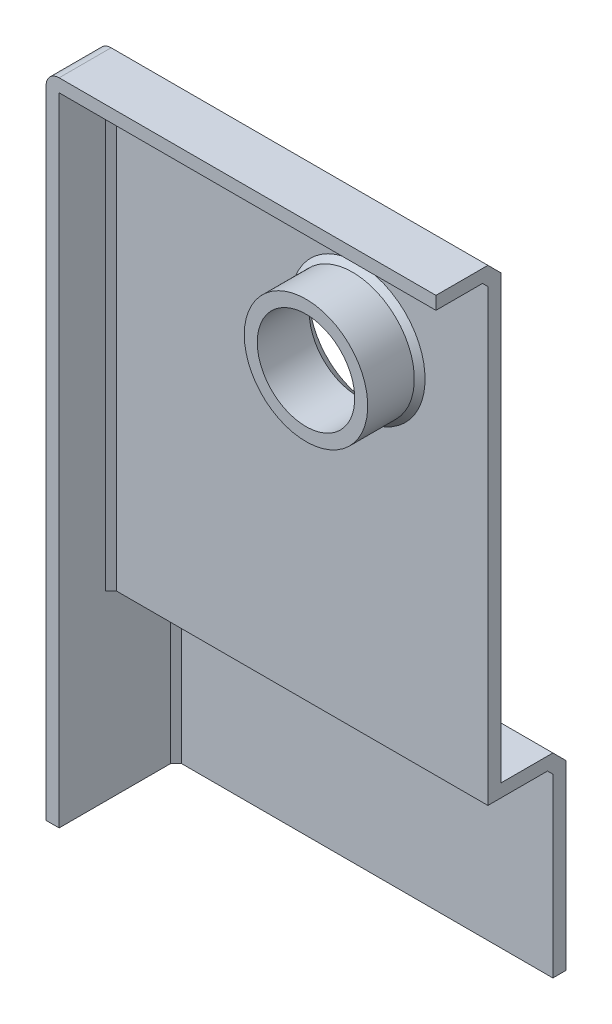
from build123d import *

# Parameters (mm, degrees)
SKETCH1_W           = 76.2
SKETCH1_H           = 127
BOSS_EXTRUDE2_DEPTH = 12.7
SKETCH2_W           = 76.2
SKETCH2_H           = 38.1
BOSS_EXTRUDE3_DEPTH = 12.7
SKETCH4_R           = 9.525
CUT_EXTRUDE1_DEPTH  = 149.649688866
FILLET1_R           = 2.54
CHAMFER1_SIZE       = 2.54
SHELL1_START        = 2.54
SHELL1_DEPTH        = 73.66
SHELL1_START_2      = 35.56
SHELL1_3_DEPTH      = 89.44
SHELL1_4_DEPTH      = 35.56


with BuildPart() as part:
    # Sketch1 → Boss-Extrude2 (new body)
    with BuildSketch(Plane.XY):
        with Locations((38.1, 63.5)):
            Rectangle(SKETCH1_W, SKETCH1_H)
    extrude(amount=BOSS_EXTRUDE2_DEPTH)

    # Sketch2 → Boss-Extrude3 (add)
    with BuildSketch(Plane(origin=(0, 0, 0), x_dir=(-1, 0, 0), z_dir=(0, 0, -1))):
        with Locations((-38.1, 19.05)):
            Rectangle(SKETCH2_W, SKETCH2_H)
    extrude(amount=BOSS_EXTRUDE3_DEPTH)

    # Sketch4 → Cut-Extrude1 (cut, through all)
    with BuildSketch(Plane(origin=(0, 0, 0), x_dir=(-1, 0, 0), z_dir=(0, 0, -1))):
        with Locations((-50.8, 101.6)):
            Circle(SKETCH4_R)
    extrude(amount=-CUT_EXTRUDE1_DEPTH, mode=Mode.SUBTRACT)

    # Fillet1
    fillet1_edges = [part.edges().sort_by_distance(p)[0] for p in [
        (0, 38.1, -6.35),
        (0, 127, 6.35),
    ]]
    fillet(fillet1_edges, radius=FILLET1_R)

    # Chamfer1
    chamfer1_edges = [part.edges().sort_by_distance(p)[0] for p in [
        (60.325, 101.6, 0),
        (0, 80.01, 0),
        (0.743948776, 126.256051224, 0),
        (39.37, 127, 0),
        (0, 17.78, -12.7),
        (0.743948776, 37.356051224, -12.7),
        (39.37, 38.1, -12.7),
    ]]
    chamfer(chamfer1_edges, length=CHAMFER1_SIZE)

    # Shell1: read off the stored shape, not the designer's step
    # Shell1 outline → Shell1 (cut)
    with BuildSketch(Plane.YZ.offset(SHELL1_START)):
        Polygon((124.46, 3.592102448), (124.46, 12.7), (0, 12.7), (0, -10.16), (34.507897552, -10.16), (35.56, -9.107897552), (35.56, 2.54), (123.407897552, 2.54), align=None)
    extrude(amount=SHELL1_DEPTH, mode=Mode.SUBTRACT)

    # Shell1 2 outline → Shell1 2 (revolve)
    with BuildSketch(Plane(origin=(50.8, 101.6, 0), x_dir=(1, 0, 0), z_dir=(0, -1, 0))):
        Polygon((12.065, 12.7), (9.525, 12.7), (9.525, 2.54), (13.117102448, 2.54), (12.065, 3.592102448), align=None)
    revolve(axis=Axis((50.8, 101.6, 0), (0, 0, 1)))

    # Shell1 3 outline → Shell1 3 (add)
    with BuildSketch(Plane(origin=(0, 0, 0), x_dir=(1, 0, 0), z_dir=(0, 1, 0)).offset(SHELL1_START_2)):
        Polygon((2.54, -3.592102448), (3.592102448, -2.54), (2.54, -2.54), align=None)
    extrude(amount=SHELL1_3_DEPTH)

    # Shell1 4 outline → Shell1 4 (add)
    with BuildSketch(Plane(origin=(0, 0, 0), x_dir=(1, 0, 0), z_dir=(0, 1, 0))):
        Polygon((2.54, 10.16), (2.54, 9.107897552), (3.592102448, 10.16), align=None)
    extrude(amount=SHELL1_4_DEPTH)


solid = part.part
